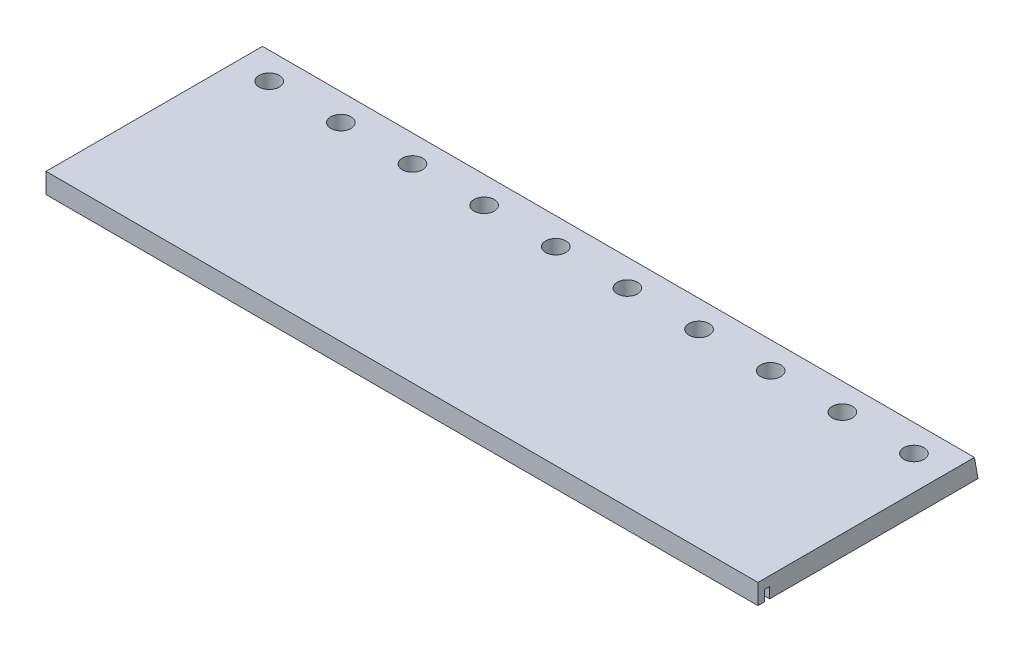
from build123d import *

# Parameters (mm, degrees)
SKETCH1_W               = 673.1
SKETCH1_H               = 208.026
BOSS_EXTRUDE1_DEPTH     = 9.525
CUT_EXTRUDE1_DEPTH      = 353.771185287
CUT_EXTRUDE1_DEPTH_BACK = 353.771185287
SKETCH2_R               = 9.584587104
SKETCH4_W               = 673.1
SKETCH4_H               = 4.699
CUT_EXTRUDE2_DEPTH      = 10.16
CUT_EXTRUDE4_DEPTH      = 353.38520442
CUT_EXTRUDE4_DEPTH_BACK = 353.38520442
CUT_EXTRUDE5_DEPTH      = 7.9375


with BuildPart() as part:
    # Sketch1 → Boss-Extrude1 (new, symmetric)
    with BuildSketch(Plane(origin=(0, 0, 0), x_dir=(1, 0, 0), z_dir=(0, 1, 0))):
        Rectangle(SKETCH1_W, SKETCH1_H)
    extrude(amount=BOSS_EXTRUDE1_DEPTH, both=True)

    # Sketch2 → Cut-Extrude1 (cut, two sides: drawn at the far end of the back side and taken through both)
    with BuildSketch(Plane(origin=(0, 9.525, 0), x_dir=(1, 0, 0), z_dir=(0, 1, 0)).offset(-CUT_EXTRUDE1_DEPTH_BACK)):
        with Locations((-304.8, 75.253971018)):
            Circle(SKETCH2_R)
        with Locations((-237.0709, 75.253971018)):
            Circle(SKETCH2_R)
        with Locations((-169.3418, 75.253971018)):
            Circle(SKETCH2_R)
        with Locations((-101.6127, 75.253971018)):
            Circle(SKETCH2_R)
        with Locations((-33.8836, 75.253971018)):
            Circle(SKETCH2_R)
        with Locations((33.8455, 75.253971018)):
            Circle(SKETCH2_R)
        with Locations((101.5746, 75.253971018)):
            Circle(SKETCH2_R)
        with Locations((169.3037, 75.253971018)):
            Circle(SKETCH2_R)
        with Locations((237.0328, 75.253971018)):
            Circle(SKETCH2_R)
        with Locations((304.7619, 75.253971018)):
            Circle(SKETCH2_R)
    extrude(amount=CUT_EXTRUDE1_DEPTH + CUT_EXTRUDE1_DEPTH_BACK, mode=Mode.SUBTRACT)

    # Sketch4 → Cut-Extrude2 (cut)
    with BuildSketch(Plane.XZ.offset(9.525)):
        with Locations((0, 95.3624458)):
            Rectangle(SKETCH4_W, SKETCH4_H)
    extrude(amount=-CUT_EXTRUDE2_DEPTH, mode=Mode.SUBTRACT)

    # Sketch6 → Cut-Extrude4 (cut, two sides: drawn at the far end of the back side and taken through both)
    with BuildSketch(Plane(origin=(0, 0, 0), x_dir=(0, 0, -1), z_dir=(1, 0, 0)).offset(-CUT_EXTRUDE4_DEPTH_BACK)):
        Polygon((104.013, -9.525), (104.013, 9.525), (100.653971018, 9.525), align=None)
    extrude(amount=CUT_EXTRUDE4_DEPTH + CUT_EXTRUDE4_DEPTH_BACK, mode=Mode.SUBTRACT)

    # Sketch7 → Cut-Extrude5 (cut)
    with BuildSketch(Plane.XZ.offset(9.525)):
        with BuildLine():
            Line((-323.05625, -24.614696465), (323.05625, -24.614696465))
            ThreePointArc((323.05625, -24.614696465), (331.05725, -32.615696465), (323.05625, -40.616696465))
            Line((323.05625, -40.616696465), (-323.05625, -40.616696465))
            ThreePointArc((-323.05625, -40.616696465), (-331.05725, -32.615696465), (-323.05625, -24.614696465))
        make_face()
    extrude(amount=-CUT_EXTRUDE5_DEPTH, mode=Mode.SUBTRACT)


solid = part.part
